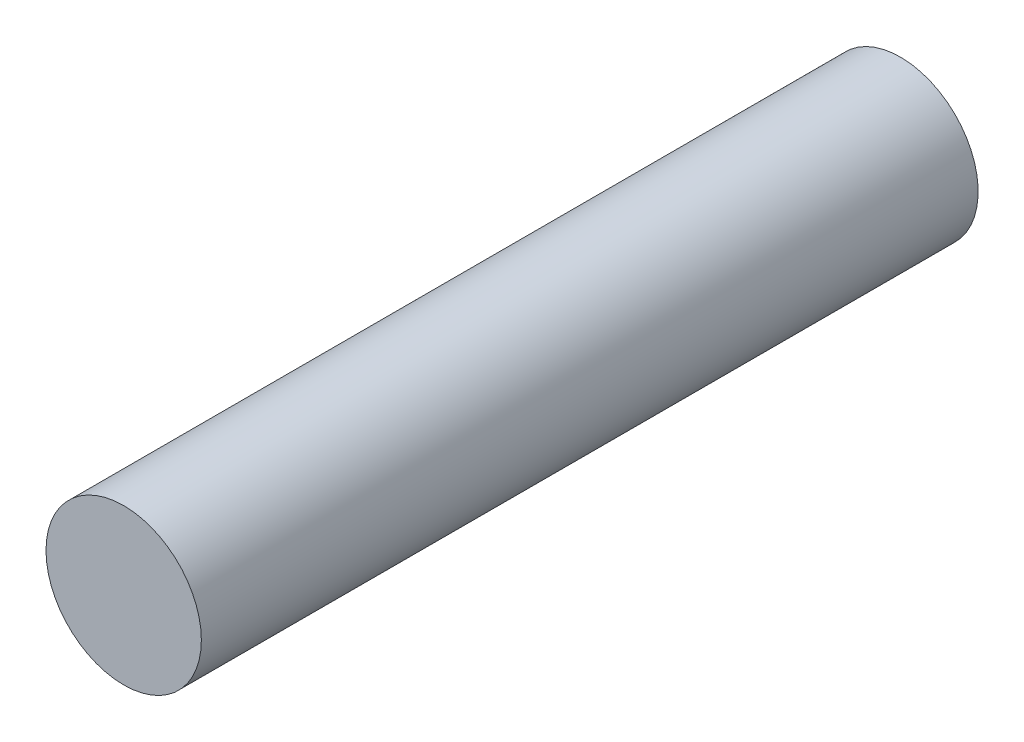
from build123d import *

# Parameters (mm, degrees)
SKETCH_1_R          = 5
EXTRUDE_1_DEPTH     = 200
SKETCH_2_R          = 5
CUT_EXTRUDE_1_DEPTH = 150


with BuildPart() as part:
    # 草图1 → 凸台-拉伸1 (new body)
    with BuildSketch(Plane.XY):
        Circle(SKETCH_1_R)
    extrude(amount=EXTRUDE_1_DEPTH)

    # 草图2 → 切除-拉伸1 (cut)
    with BuildSketch(Plane(origin=(0, 0, 0), x_dir=(-1, 0, 0), z_dir=(0, 0, -1))):
        Circle(SKETCH_2_R)
    extrude(amount=-CUT_EXTRUDE_1_DEPTH, mode=Mode.SUBTRACT)


solid = part.part
